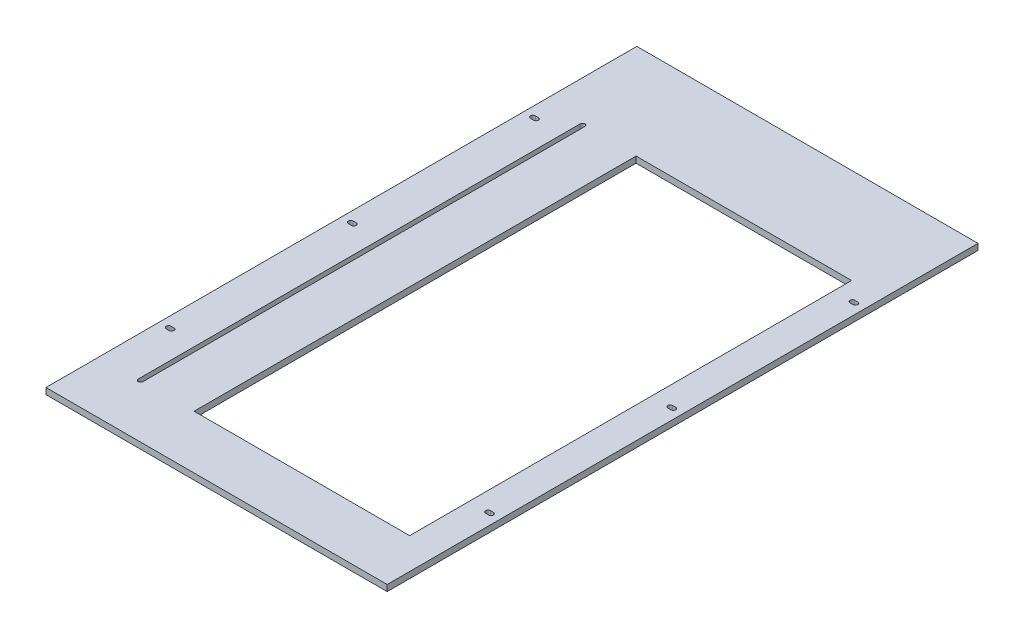
from build123d import *

# Parameters (mm, degrees)
SKETCH_1_W              = 220
SKETCH_1_H              = 381
EXTRUDE_1_DEPTH         = 4
HOLE_WIZARD_2_9_2_9_1_D = 2.9
SKETCH_6_W              = 139
SKETCH_6_H              = 285
CUT_EXTRUDE_2_DEPTH     = 225.945898173
SKETCH_7_R              = 1.45
CUT_EXTRUDE_3_DEPTH     = 225.945898173
CUT_EXTRUDE_4_DEPTH     = 225.945898173


with BuildPart() as part:
    # 草圖1 → 填料-伸長1 (new body)
    with BuildSketch(Plane(origin=(0, 0, 0), x_dir=(1, 0, 0), z_dir=(0, 1, 0))):
        with Locations((-3.755314961, 3.521610711)):
            Rectangle(SKETCH_1_W, SKETCH_1_H)
    extrude(amount=-EXTRUDE_1_DEPTH)

    # Ø2.9 (2.9) 直徑孔1 (through all)
    with Locations(Plane(origin=(-106.755314961, 0, -121.021610711), x_dir=(0, 0, 1), z_dir=(0, 1, 0))):
        with Locations((0, 0), (117.5, 0), (235, 0), (235, 206), (117.5, 206), (0, 206)):
            Hole(HOLE_WIZARD_2_9_2_9_1_D / 2)

    # 草圖6 → 除料-伸長2 (cut, through all)
    with BuildSketch(Plane(origin=(0, 0, 0), x_dir=(1, 0, 0), z_dir=(0, 1, 0))):
        with Locations((16.744685039, -9.978389289)):
            Rectangle(SKETCH_6_W, SKETCH_6_H)
    extrude(amount=-CUT_EXTRUDE_2_DEPTH, mode=Mode.SUBTRACT)

    # 草圖7 → 除料-伸長3 (cut, through all)
    # profile 1 of 6: a face of its own
    with BuildSketch(Plane(origin=(0, 0, 0), x_dir=(1, 0, 0), z_dir=(0, 1, 0))):
        with BuildLine():
            Line((-105.755314961, 122.521610711), (-107.755314961, 122.521610711))
            ThreePointArc((-107.755314961, 122.521610711), (-109.255314961, 121.021610711), (-107.755314961, 119.521610711))
            Line((-107.755314961, 119.521610711), (-105.755314961, 119.521610711))
            ThreePointArc((-105.755314961, 119.521610711), (-104.255314961, 121.021610711), (-105.755314961, 122.521610711))
        make_face()
    # profile 2 of 6: a face of its own
    with BuildSketch(Plane(origin=(0, 0, 0), x_dir=(1, 0, 0), z_dir=(0, 1, 0))):
        with BuildLine():
            Line((100.244685039, 122.521610711), (98.244685039, 122.521610711))
            ThreePointArc((98.244685039, 122.521610711), (96.744685039, 121.021610711), (98.244685039, 119.521610711))
            Line((98.244685039, 119.521610711), (100.244685039, 119.521610711))
            ThreePointArc((100.244685039, 119.521610711), (101.744685039, 121.021610711), (100.244685039, 122.521610711))
        make_face()
        with Locations((99.244685039, 121.021610711)):
            Circle(SKETCH_7_R, mode=Mode.SUBTRACT)
    # profile 3 of 6: a face of its own
    with BuildSketch(Plane(origin=(0, 0, 0), x_dir=(1, 0, 0), z_dir=(0, 1, 0))):
        with BuildLine():
            Line((100.244685039, 5.021610711), (98.244685039, 5.021610711))
            ThreePointArc((98.244685039, 5.021610711), (96.744685039, 3.521610711), (98.244685039, 2.021610711))
            Line((98.244685039, 2.021610711), (100.244685039, 2.021610711))
            ThreePointArc((100.244685039, 2.021610711), (101.744685039, 3.521610711), (100.244685039, 5.021610711))
        make_face()
        with Locations((99.244685039, 3.521610711)):
            Circle(SKETCH_7_R, mode=Mode.SUBTRACT)
    # profile 4 of 6: a face of its own
    with BuildSketch(Plane(origin=(0, 0, 0), x_dir=(1, 0, 0), z_dir=(0, 1, 0))):
        with BuildLine():
            Line((100.244685039, -112.478389289), (98.244685039, -112.478389289))
            ThreePointArc((98.244685039, -112.478389289), (96.744685039, -113.978389289), (98.244685039, -115.478389289))
            Line((98.244685039, -115.478389289), (100.244685039, -115.478389289))
            ThreePointArc((100.244685039, -115.478389289), (101.744685039, -113.978389289), (100.244685039, -112.478389289))
        make_face()
        with Locations((99.244685039, -113.978389289)):
            Circle(SKETCH_7_R, mode=Mode.SUBTRACT)
    # profile 5 of 6: a face of its own
    with BuildSketch(Plane(origin=(0, 0, 0), x_dir=(1, 0, 0), z_dir=(0, 1, 0))):
        with BuildLine():
            Line((-105.755314961, 5.021610711), (-107.755314961, 5.021610711))
            ThreePointArc((-107.755314961, 5.021610711), (-109.255314961, 3.521610711), (-107.755314961, 2.021610711))
            Line((-107.755314961, 2.021610711), (-105.755314961, 2.021610711))
            ThreePointArc((-105.755314961, 2.021610711), (-104.255314961, 3.521610711), (-105.755314961, 5.021610711))
        make_face()
        with Locations((-106.755314961, 3.521610711)):
            Circle(SKETCH_7_R, mode=Mode.SUBTRACT)
    # profile 6 of 6: a face of its own
    with BuildSketch(Plane(origin=(0, 0, 0), x_dir=(1, 0, 0), z_dir=(0, 1, 0))):
        with BuildLine():
            Line((-105.755314961, -112.478389289), (-107.755314961, -112.478389289))
            ThreePointArc((-107.755314961, -112.478389289), (-109.255314961, -113.978389289), (-107.755314961, -115.478389289))
            Line((-107.755314961, -115.478389289), (-105.755314961, -115.478389289))
            ThreePointArc((-105.755314961, -115.478389289), (-104.255314961, -113.978389289), (-105.755314961, -112.478389289))
        make_face()
    extrude(amount=-CUT_EXTRUDE_3_DEPTH, mode=Mode.SUBTRACT)

    # 草圖8 → 除料-伸長4 (cut, through all)
    with BuildSketch(Plane(origin=(0, 0, 0), x_dir=(1, 0, 0), z_dir=(0, 1, 0))):
        with BuildLine():
            Line((-85.755314961, 132.521610711), (-85.755314961, -152.478389289))
            ThreePointArc((-85.755314961, -152.478389289), (-87.255314961, -153.978389289), (-88.755314961, -152.478389289))
            Line((-88.755314961, -152.478389289), (-88.755314961, 132.521610711))
            ThreePointArc((-88.755314961, 132.521610711), (-87.255314961, 134.021610711), (-85.755314961, 132.521610711))
        make_face()
    extrude(amount=-CUT_EXTRUDE_4_DEPTH, mode=Mode.SUBTRACT)


solid = part.part
